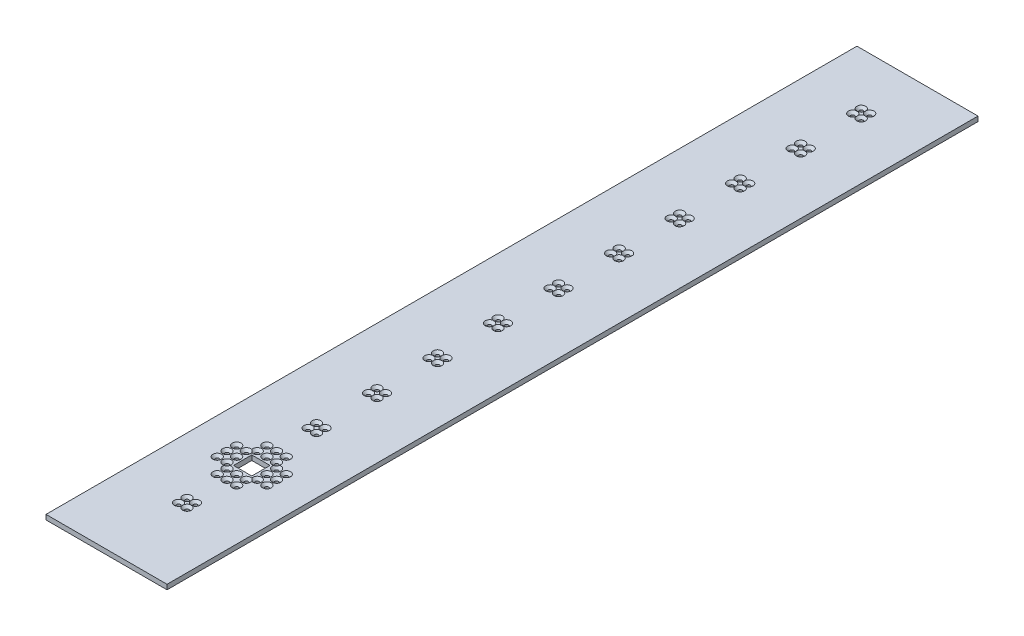
from build123d import *

# Parameters (mm, degrees)
SKETCH_1_W      = 100
SKETCH_1_H      = 670
SKETCH_1_R      = 1.6
SKETCH_1_W_2    = 15.1
SKETCH_1_H_2    = 15.1
EXTRUDE_1_DEPTH = 4
CHAMFER_1_SIZE  = 2


with BuildPart() as part:
    # 草图1 → 凸台-拉伸1 (new body)
    with BuildSketch(Plane(origin=(0, 0, 0), x_dir=(1, 0, 0), z_dir=(0, 1, 0))):
        Rectangle(SKETCH_1_W, SKETCH_1_H)
        with Locations(Location((0, -202.5, 0), (0, 0, 270))):
            Circle(SKETCH_1_R, mode=Mode.SUBTRACT)
        with Locations(Location((0, -194.5, 0), (0, 0, 270))):
            Circle(SKETCH_1_R, mode=Mode.SUBTRACT)
        with Locations(Location((8, -194.5, 0), (0, 0, 270))):
            Circle(SKETCH_1_R, mode=Mode.SUBTRACT)
        with Locations(Location((8, -202.5, 0), (0, 0, 270))):
            Circle(SKETCH_1_R, mode=Mode.SUBTRACT)
        with Locations(Location((-8, -194.5, 0), (0, 0, 270))):
            Circle(SKETCH_1_R, mode=Mode.SUBTRACT)
        with Locations(Location((-8, -202.5, 0), (0, 0, 270))):
            Circle(SKETCH_1_R, mode=Mode.SUBTRACT)
        with Locations(Location((20.5, -207, 0), (0, 0, 270))):
            Circle(SKETCH_1_R, mode=Mode.SUBTRACT)
        with Locations(Location((12.5, -207, 0), (0, 0, 270))):
            Circle(SKETCH_1_R, mode=Mode.SUBTRACT)
        with Locations(Location((12.5, -215, 0), (0, 0, 270))):
            Circle(SKETCH_1_R, mode=Mode.SUBTRACT)
        with Locations(Location((20.5, -215, 0), (0, 0, 270))):
            Circle(SKETCH_1_R, mode=Mode.SUBTRACT)
        with Locations(Location((20.5, -223, 0), (0, 0, 270))):
            Circle(SKETCH_1_R, mode=Mode.SUBTRACT)
        with Locations(Location((12.5, -223, 0), (0, 0, 270))):
            Circle(SKETCH_1_R, mode=Mode.SUBTRACT)
        with Locations(Location((8, -235.5, 0), (0, 0, 270))):
            Circle(SKETCH_1_R, mode=Mode.SUBTRACT)
        with Locations(Location((8, -227.5, 0), (0, 0, 270))):
            Circle(SKETCH_1_R, mode=Mode.SUBTRACT)
        with Locations(Location((0, -227.5, 0), (0, 0, 270))):
            Circle(SKETCH_1_R, mode=Mode.SUBTRACT)
        with Locations(Location((0, -235.5, 0), (0, 0, 270))):
            Circle(SKETCH_1_R, mode=Mode.SUBTRACT)
        with Locations(Location((-8, -235.5, 0), (0, 0, 270))):
            Circle(SKETCH_1_R, mode=Mode.SUBTRACT)
        with Locations(Location((-8, -227.5, 0), (0, 0, 270))):
            Circle(SKETCH_1_R, mode=Mode.SUBTRACT)
        with Locations(Location((-20.5, -223, 0), (0, 0, 270))):
            Circle(SKETCH_1_R, mode=Mode.SUBTRACT)
        with Locations(Location((-12.5, -223, 0), (0, 0, 270))):
            Circle(SKETCH_1_R, mode=Mode.SUBTRACT)
        with Locations(Location((-12.5, -215, 0), (0, 0, 270))):
            Circle(SKETCH_1_R, mode=Mode.SUBTRACT)
        with Locations(Location((-20.5, -215, 0), (0, 0, 270))):
            Circle(SKETCH_1_R, mode=Mode.SUBTRACT)
        with Locations(Location((-20.5, -207, 0), (0, 0, 270))):
            Circle(SKETCH_1_R, mode=Mode.SUBTRACT)
        with Locations(Location((-12.5, -207, 0), (0, 0, 270))):
            Circle(SKETCH_1_R, mode=Mode.SUBTRACT)
        with Locations(Location((-3.5, -165, 0), (0, 0, 270))):
            Circle(SKETCH_1_R, mode=Mode.SUBTRACT)
        with Locations(Location((3.5, -165, 0), (0, 0, 90))):
            Circle(SKETCH_1_R, mode=Mode.SUBTRACT)
        with Locations(Location((-3.5, -158, 0), (0, 0, 270))):
            Circle(SKETCH_1_R, mode=Mode.SUBTRACT)
        with Locations(Location((3.5, -158, 0), (0, 0, 90))):
            Circle(SKETCH_1_R, mode=Mode.SUBTRACT)
        with Locations(Location((-3.5, -108, 0), (0, 0, 270))):
            Circle(SKETCH_1_R, mode=Mode.SUBTRACT)
        with Locations(Location((-3.5, -115, 0), (0, 0, 270))):
            Circle(SKETCH_1_R, mode=Mode.SUBTRACT)
        with Locations(Location((3.5, -115, 0), (0, 0, 90))):
            Circle(SKETCH_1_R, mode=Mode.SUBTRACT)
        with Locations(Location((3.5, -108, 0), (0, 0, 90))):
            Circle(SKETCH_1_R, mode=Mode.SUBTRACT)
        with Locations(Location((-3.5, -58, 0), (0, 0, 270))):
            Circle(SKETCH_1_R, mode=Mode.SUBTRACT)
        with Locations(Location((-3.5, -65, 0), (0, 0, 270))):
            Circle(SKETCH_1_R, mode=Mode.SUBTRACT)
        with Locations(Location((3.5, -65, 0), (0, 0, 90))):
            Circle(SKETCH_1_R, mode=Mode.SUBTRACT)
        with Locations(Location((3.5, -58, 0), (0, 0, 90))):
            Circle(SKETCH_1_R, mode=Mode.SUBTRACT)
        with Locations(Location((-3.5, -8, 0), (0, 0, 270))):
            Circle(SKETCH_1_R, mode=Mode.SUBTRACT)
        with Locations(Location((-3.5, -15, 0), (0, 0, 270))):
            Circle(SKETCH_1_R, mode=Mode.SUBTRACT)
        with Locations(Location((3.5, -15, 0), (0, 0, 90))):
            Circle(SKETCH_1_R, mode=Mode.SUBTRACT)
        with Locations(Location((3.5, -8, 0), (0, 0, 90))):
            Circle(SKETCH_1_R, mode=Mode.SUBTRACT)
        with Locations(Location((-3.5, 42, 0), (0, 0, 270))):
            Circle(SKETCH_1_R, mode=Mode.SUBTRACT)
        with Locations(Location((-3.5, 35, 0), (0, 0, 270))):
            Circle(SKETCH_1_R, mode=Mode.SUBTRACT)
        with Locations(Location((3.5, 35, 0), (0, 0, 90))):
            Circle(SKETCH_1_R, mode=Mode.SUBTRACT)
        with Locations(Location((3.5, 42, 0), (0, 0, 90))):
            Circle(SKETCH_1_R, mode=Mode.SUBTRACT)
        with Locations(Location((-3.5, 92, 0), (0, 0, 270))):
            Circle(SKETCH_1_R, mode=Mode.SUBTRACT)
        with Locations(Location((-3.5, 85, 0), (0, 0, 270))):
            Circle(SKETCH_1_R, mode=Mode.SUBTRACT)
        with Locations(Location((3.5, 85, 0), (0, 0, 90))):
            Circle(SKETCH_1_R, mode=Mode.SUBTRACT)
        with Locations(Location((3.5, 92, 0), (0, 0, 90))):
            Circle(SKETCH_1_R, mode=Mode.SUBTRACT)
        with Locations(Location((-3.5, 142, 0), (0, 0, 270))):
            Circle(SKETCH_1_R, mode=Mode.SUBTRACT)
        with Locations(Location((-3.5, 135, 0), (0, 0, 270))):
            Circle(SKETCH_1_R, mode=Mode.SUBTRACT)
        with Locations(Location((3.5, 135, 0), (0, 0, 90))):
            Circle(SKETCH_1_R, mode=Mode.SUBTRACT)
        with Locations(Location((3.5, 142, 0), (0, 0, 90))):
            Circle(SKETCH_1_R, mode=Mode.SUBTRACT)
        with Locations(Location((-3.5, 192, 0), (0, 0, 270))):
            Circle(SKETCH_1_R, mode=Mode.SUBTRACT)
        with Locations(Location((-3.5, 185, 0), (0, 0, 270))):
            Circle(SKETCH_1_R, mode=Mode.SUBTRACT)
        with Locations(Location((3.5, 185, 0), (0, 0, 90))):
            Circle(SKETCH_1_R, mode=Mode.SUBTRACT)
        with Locations(Location((3.5, 192, 0), (0, 0, 90))):
            Circle(SKETCH_1_R, mode=Mode.SUBTRACT)
        with Locations(Location((-3.5, 242, 0), (0, 0, 270))):
            Circle(SKETCH_1_R, mode=Mode.SUBTRACT)
        with Locations(Location((-3.5, 235, 0), (0, 0, 270))):
            Circle(SKETCH_1_R, mode=Mode.SUBTRACT)
        with Locations(Location((3.5, 235, 0), (0, 0, 90))):
            Circle(SKETCH_1_R, mode=Mode.SUBTRACT)
        with Locations(Location((3.5, 242, 0), (0, 0, 90))):
            Circle(SKETCH_1_R, mode=Mode.SUBTRACT)
        with Locations(Location((-3.5, 292, 0), (0, 0, 270))):
            Circle(SKETCH_1_R, mode=Mode.SUBTRACT)
        with Locations(Location((-3.5, 285, 0), (0, 0, 270))):
            Circle(SKETCH_1_R, mode=Mode.SUBTRACT)
        with Locations(Location((3.5, 285, 0), (0, 0, 90))):
            Circle(SKETCH_1_R, mode=Mode.SUBTRACT)
        with Locations(Location((3.5, 292, 0), (0, 0, 90))):
            Circle(SKETCH_1_R, mode=Mode.SUBTRACT)
        with Locations(Location((3.5, -265, 0), (0, 0, 270))):
            Circle(SKETCH_1_R, mode=Mode.SUBTRACT)
        with Locations(Location((3.5, -272, 0), (0, 0, 270))):
            Circle(SKETCH_1_R, mode=Mode.SUBTRACT)
        with Locations(Location((-3.5, -272, 0), (0, 0, 90))):
            Circle(SKETCH_1_R, mode=Mode.SUBTRACT)
        with Locations(Location((-3.5, -265, 0), (0, 0, 90))):
            Circle(SKETCH_1_R, mode=Mode.SUBTRACT)
        with Locations((0, -215)):
            Rectangle(SKETCH_1_W_2, SKETCH_1_H_2, mode=Mode.SUBTRACT)
    extrude(amount=EXTRUDE_1_DEPTH)

    # 倒角1
    # the kernel refuses this chamfer: 2 mm, written as the material it takes off along each edge
    with BuildSketch(Plane(origin=(-20.5, 4, 215), x_dir=(0, 0, 1), z_dir=(-1, 0, 0))) as chamfer_1_piece_1:
        Polygon((1.6, -CHAMFER_1_SIZE), (1.6 + CHAMFER_1_SIZE, 0), (1.6, 0), align=None)
    chamfer_1_piece_1_solid = revolve(axis=Axis((-20.5, 4, 215), (0, 1, 0)), mode=Mode.PRIVATE)
    with BuildSketch(Plane(origin=(-12.5, 4, 207), x_dir=(0, 0, 1), z_dir=(-1, 0, 0))) as chamfer_1_piece_2:
        Polygon((1.6, -CHAMFER_1_SIZE), (1.6 + CHAMFER_1_SIZE, 0), (1.6, 0), align=None)
    chamfer_1_piece_2_solid = revolve(axis=Axis((-12.5, 4, 207), (0, 1, 0)), mode=Mode.PRIVATE)
    with BuildSketch(Plane(origin=(-20.5, 4, 207), x_dir=(0, 0, 1), z_dir=(-1, 0, 0))) as chamfer_1_piece_3:
        Polygon((1.6, -CHAMFER_1_SIZE), (1.6 + CHAMFER_1_SIZE, 0), (1.6, 0), align=None)
    chamfer_1_piece_3_solid = revolve(axis=Axis((-20.5, 4, 207), (0, 1, 0)), mode=Mode.PRIVATE)
    with BuildSketch(Plane(origin=(-12.5, 4, 223), x_dir=(0, 0, 1), z_dir=(-1, 0, 0))) as chamfer_1_piece_4:
        Polygon((1.6, -CHAMFER_1_SIZE), (1.6 + CHAMFER_1_SIZE, 0), (1.6, 0), align=None)
    chamfer_1_piece_4_solid = revolve(axis=Axis((-12.5, 4, 223), (0, 1, 0)), mode=Mode.PRIVATE)
    with BuildSketch(Plane(origin=(-20.5, 4, 223), x_dir=(0, 0, 1), z_dir=(-1, 0, 0))) as chamfer_1_piece_5:
        Polygon((1.6, -CHAMFER_1_SIZE), (1.6 + CHAMFER_1_SIZE, 0), (1.6, 0), align=None)
    chamfer_1_piece_5_solid = revolve(axis=Axis((-20.5, 4, 223), (0, 1, 0)), mode=Mode.PRIVATE)
    with BuildSketch(Plane(origin=(3.5, 4, 165), x_dir=(0, 0, -1), z_dir=(1, 0, 0))) as chamfer_1_piece_6:
        Polygon((1.6, -CHAMFER_1_SIZE), (1.6 + CHAMFER_1_SIZE, 0), (1.6, 0), align=None)
    chamfer_1_piece_6_solid = revolve(axis=Axis((3.5, 4, 165), (0, 1, 0)), mode=Mode.PRIVATE)
    with BuildSketch(Plane(origin=(-3.5, 4, 158), x_dir=(0, 0, 1), z_dir=(-1, 0, 0))) as chamfer_1_piece_7:
        Polygon((1.6, -CHAMFER_1_SIZE), (1.6 + CHAMFER_1_SIZE, 0), (1.6, 0), align=None)
    chamfer_1_piece_7_solid = revolve(axis=Axis((-3.5, 4, 158), (0, 1, 0)), mode=Mode.PRIVATE)
    with BuildSketch(Plane(origin=(3.5, 4, 158), x_dir=(0, 0, -1), z_dir=(1, 0, 0))) as chamfer_1_piece_8:
        Polygon((1.6, -CHAMFER_1_SIZE), (1.6 + CHAMFER_1_SIZE, 0), (1.6, 0), align=None)
    chamfer_1_piece_8_solid = revolve(axis=Axis((3.5, 4, 158), (0, 1, 0)), mode=Mode.PRIVATE)
    with BuildSketch(Plane(origin=(-3.5, 4, 115), x_dir=(0, 0, 1), z_dir=(-1, 0, 0))) as chamfer_1_piece_9:
        Polygon((1.6, -CHAMFER_1_SIZE), (1.6 + CHAMFER_1_SIZE, 0), (1.6, 0), align=None)
    chamfer_1_piece_9_solid = revolve(axis=Axis((-3.5, 4, 115), (0, 1, 0)), mode=Mode.PRIVATE)
    with BuildSketch(Plane(origin=(3.5, 4, 115), x_dir=(0, 0, -1), z_dir=(1, 0, 0))) as chamfer_1_piece_10:
        Polygon((1.6, -CHAMFER_1_SIZE), (1.6 + CHAMFER_1_SIZE, 0), (1.6, 0), align=None)
    chamfer_1_piece_10_solid = revolve(axis=Axis((3.5, 4, 115), (0, 1, 0)), mode=Mode.PRIVATE)
    with BuildSketch(Plane(origin=(-3.5, 4, 108), x_dir=(0, 0, 1), z_dir=(-1, 0, 0))) as chamfer_1_piece_11:
        Polygon((1.6, -CHAMFER_1_SIZE), (1.6 + CHAMFER_1_SIZE, 0), (1.6, 0), align=None)
    chamfer_1_piece_11_solid = revolve(axis=Axis((-3.5, 4, 108), (0, 1, 0)), mode=Mode.PRIVATE)
    with BuildSketch(Plane(origin=(3.5, 4, 108), x_dir=(0, 0, -1), z_dir=(1, 0, 0))) as chamfer_1_piece_12:
        Polygon((1.6, -CHAMFER_1_SIZE), (1.6 + CHAMFER_1_SIZE, 0), (1.6, 0), align=None)
    chamfer_1_piece_12_solid = revolve(axis=Axis((3.5, 4, 108), (0, 1, 0)), mode=Mode.PRIVATE)
    with BuildSketch(Plane(origin=(-3.5, 4, 65), x_dir=(0, 0, 1), z_dir=(-1, 0, 0))) as chamfer_1_piece_13:
        Polygon((1.6, -CHAMFER_1_SIZE), (1.6 + CHAMFER_1_SIZE, 0), (1.6, 0), align=None)
    chamfer_1_piece_13_solid = revolve(axis=Axis((-3.5, 4, 65), (0, 1, 0)), mode=Mode.PRIVATE)
    with BuildSketch(Plane(origin=(3.5, 4, 65), x_dir=(0, 0, -1), z_dir=(1, 0, 0))) as chamfer_1_piece_14:
        Polygon((1.6, -CHAMFER_1_SIZE), (1.6 + CHAMFER_1_SIZE, 0), (1.6, 0), align=None)
    chamfer_1_piece_14_solid = revolve(axis=Axis((3.5, 4, 65), (0, 1, 0)), mode=Mode.PRIVATE)
    with BuildSketch(Plane(origin=(-3.5, 4, 58), x_dir=(0, 0, 1), z_dir=(-1, 0, 0))) as chamfer_1_piece_15:
        Polygon((1.6, -CHAMFER_1_SIZE), (1.6 + CHAMFER_1_SIZE, 0), (1.6, 0), align=None)
    chamfer_1_piece_15_solid = revolve(axis=Axis((-3.5, 4, 58), (0, 1, 0)), mode=Mode.PRIVATE)
    with BuildSketch(Plane(origin=(3.5, 4, 58), x_dir=(0, 0, -1), z_dir=(1, 0, 0))) as chamfer_1_piece_16:
        Polygon((1.6, -CHAMFER_1_SIZE), (1.6 + CHAMFER_1_SIZE, 0), (1.6, 0), align=None)
    chamfer_1_piece_16_solid = revolve(axis=Axis((3.5, 4, 58), (0, 1, 0)), mode=Mode.PRIVATE)
    with BuildSketch(Plane(origin=(-3.5, 4, 15), x_dir=(0, 0, 1), z_dir=(-1, 0, 0))) as chamfer_1_piece_17:
        Polygon((1.6, -CHAMFER_1_SIZE), (1.6 + CHAMFER_1_SIZE, 0), (1.6, 0), align=None)
    chamfer_1_piece_17_solid = revolve(axis=Axis((-3.5, 4, 15), (0, 1, 0)), mode=Mode.PRIVATE)
    with BuildSketch(Plane(origin=(3.5, 4, 15), x_dir=(0, 0, -1), z_dir=(1, 0, 0))) as chamfer_1_piece_18:
        Polygon((1.6, -CHAMFER_1_SIZE), (1.6 + CHAMFER_1_SIZE, 0), (1.6, 0), align=None)
    chamfer_1_piece_18_solid = revolve(axis=Axis((3.5, 4, 15), (0, 1, 0)), mode=Mode.PRIVATE)
    with BuildSketch(Plane(origin=(-3.5, 4, 8), x_dir=(0, 0, 1), z_dir=(-1, 0, 0))) as chamfer_1_piece_19:
        Polygon((1.6, -CHAMFER_1_SIZE), (1.6 + CHAMFER_1_SIZE, 0), (1.6, 0), align=None)
    chamfer_1_piece_19_solid = revolve(axis=Axis((-3.5, 4, 8), (0, 1, 0)), mode=Mode.PRIVATE)
    with BuildSketch(Plane(origin=(3.5, 4, 8), x_dir=(0, 0, -1), z_dir=(1, 0, 0))) as chamfer_1_piece_20:
        Polygon((1.6, -CHAMFER_1_SIZE), (1.6 + CHAMFER_1_SIZE, 0), (1.6, 0), align=None)
    chamfer_1_piece_20_solid = revolve(axis=Axis((3.5, 4, 8), (0, 1, 0)), mode=Mode.PRIVATE)
    with BuildSketch(Plane(origin=(-3.5, 4, -35), x_dir=(0, 0, 1), z_dir=(-1, 0, 0))) as chamfer_1_piece_21:
        Polygon((1.6, -CHAMFER_1_SIZE), (1.6 + CHAMFER_1_SIZE, 0), (1.6, 0), align=None)
    chamfer_1_piece_21_solid = revolve(axis=Axis((-3.5, 4, -35), (0, 1, 0)), mode=Mode.PRIVATE)
    with BuildSketch(Plane(origin=(3.5, 4, -35), x_dir=(0, 0, -1), z_dir=(1, 0, 0))) as chamfer_1_piece_22:
        Polygon((1.6, -CHAMFER_1_SIZE), (1.6 + CHAMFER_1_SIZE, 0), (1.6, 0), align=None)
    chamfer_1_piece_22_solid = revolve(axis=Axis((3.5, 4, -35), (0, 1, 0)), mode=Mode.PRIVATE)
    with BuildSketch(Plane(origin=(-3.5, 4, -42), x_dir=(0, 0, 1), z_dir=(-1, 0, 0))) as chamfer_1_piece_23:
        Polygon((1.6, -CHAMFER_1_SIZE), (1.6 + CHAMFER_1_SIZE, 0), (1.6, 0), align=None)
    chamfer_1_piece_23_solid = revolve(axis=Axis((-3.5, 4, -42), (0, 1, 0)), mode=Mode.PRIVATE)
    with BuildSketch(Plane(origin=(3.5, 4, -42), x_dir=(0, 0, -1), z_dir=(1, 0, 0))) as chamfer_1_piece_24:
        Polygon((1.6, -CHAMFER_1_SIZE), (1.6 + CHAMFER_1_SIZE, 0), (1.6, 0), align=None)
    chamfer_1_piece_24_solid = revolve(axis=Axis((3.5, 4, -42), (0, 1, 0)), mode=Mode.PRIVATE)
    with BuildSketch(Plane(origin=(-3.5, 4, -85), x_dir=(0, 0, 1), z_dir=(-1, 0, 0))) as chamfer_1_piece_25:
        Polygon((1.6, -CHAMFER_1_SIZE), (1.6 + CHAMFER_1_SIZE, 0), (1.6, 0), align=None)
    chamfer_1_piece_25_solid = revolve(axis=Axis((-3.5, 4, -85), (0, 1, 0)), mode=Mode.PRIVATE)
    with BuildSketch(Plane(origin=(3.5, 4, -85), x_dir=(0, 0, -1), z_dir=(1, 0, 0))) as chamfer_1_piece_26:
        Polygon((1.6, -CHAMFER_1_SIZE), (1.6 + CHAMFER_1_SIZE, 0), (1.6, 0), align=None)
    chamfer_1_piece_26_solid = revolve(axis=Axis((3.5, 4, -85), (0, 1, 0)), mode=Mode.PRIVATE)
    with BuildSketch(Plane(origin=(-3.5, 4, -92), x_dir=(0, 0, 1), z_dir=(-1, 0, 0))) as chamfer_1_piece_27:
        Polygon((1.6, -CHAMFER_1_SIZE), (1.6 + CHAMFER_1_SIZE, 0), (1.6, 0), align=None)
    chamfer_1_piece_27_solid = revolve(axis=Axis((-3.5, 4, -92), (0, 1, 0)), mode=Mode.PRIVATE)
    with BuildSketch(Plane(origin=(3.5, 4, -92), x_dir=(0, 0, -1), z_dir=(1, 0, 0))) as chamfer_1_piece_28:
        Polygon((1.6, -CHAMFER_1_SIZE), (1.6 + CHAMFER_1_SIZE, 0), (1.6, 0), align=None)
    chamfer_1_piece_28_solid = revolve(axis=Axis((3.5, 4, -92), (0, 1, 0)), mode=Mode.PRIVATE)
    with BuildSketch(Plane(origin=(-3.5, 4, -135), x_dir=(0, 0, 1), z_dir=(-1, 0, 0))) as chamfer_1_piece_29:
        Polygon((1.6, -CHAMFER_1_SIZE), (1.6 + CHAMFER_1_SIZE, 0), (1.6, 0), align=None)
    chamfer_1_piece_29_solid = revolve(axis=Axis((-3.5, 4, -135), (0, 1, 0)), mode=Mode.PRIVATE)
    with BuildSketch(Plane(origin=(3.5, 4, -135), x_dir=(0, 0, -1), z_dir=(1, 0, 0))) as chamfer_1_piece_30:
        Polygon((1.6, -CHAMFER_1_SIZE), (1.6 + CHAMFER_1_SIZE, 0), (1.6, 0), align=None)
    chamfer_1_piece_30_solid = revolve(axis=Axis((3.5, 4, -135), (0, 1, 0)), mode=Mode.PRIVATE)
    with BuildSketch(Plane(origin=(-3.5, 4, -142), x_dir=(0, 0, 1), z_dir=(-1, 0, 0))) as chamfer_1_piece_31:
        Polygon((1.6, -CHAMFER_1_SIZE), (1.6 + CHAMFER_1_SIZE, 0), (1.6, 0), align=None)
    chamfer_1_piece_31_solid = revolve(axis=Axis((-3.5, 4, -142), (0, 1, 0)), mode=Mode.PRIVATE)
    with BuildSketch(Plane(origin=(3.5, 4, -142), x_dir=(0, 0, -1), z_dir=(1, 0, 0))) as chamfer_1_piece_32:
        Polygon((1.6, -CHAMFER_1_SIZE), (1.6 + CHAMFER_1_SIZE, 0), (1.6, 0), align=None)
    chamfer_1_piece_32_solid = revolve(axis=Axis((3.5, 4, -142), (0, 1, 0)), mode=Mode.PRIVATE)
    with BuildSketch(Plane(origin=(-3.5, 4, -185), x_dir=(0, 0, 1), z_dir=(-1, 0, 0))) as chamfer_1_piece_33:
        Polygon((1.6, -CHAMFER_1_SIZE), (1.6 + CHAMFER_1_SIZE, 0), (1.6, 0), align=None)
    chamfer_1_piece_33_solid = revolve(axis=Axis((-3.5, 4, -185), (0, 1, 0)), mode=Mode.PRIVATE)
    with BuildSketch(Plane(origin=(3.5, 4, -185), x_dir=(0, 0, -1), z_dir=(1, 0, 0))) as chamfer_1_piece_34:
        Polygon((1.6, -CHAMFER_1_SIZE), (1.6 + CHAMFER_1_SIZE, 0), (1.6, 0), align=None)
    chamfer_1_piece_34_solid = revolve(axis=Axis((3.5, 4, -185), (0, 1, 0)), mode=Mode.PRIVATE)
    with BuildSketch(Plane(origin=(-3.5, 4, -192), x_dir=(0, 0, 1), z_dir=(-1, 0, 0))) as chamfer_1_piece_35:
        Polygon((1.6, -CHAMFER_1_SIZE), (1.6 + CHAMFER_1_SIZE, 0), (1.6, 0), align=None)
    chamfer_1_piece_35_solid = revolve(axis=Axis((-3.5, 4, -192), (0, 1, 0)), mode=Mode.PRIVATE)
    with BuildSketch(Plane(origin=(3.5, 4, -192), x_dir=(0, 0, -1), z_dir=(1, 0, 0))) as chamfer_1_piece_36:
        Polygon((1.6, -CHAMFER_1_SIZE), (1.6 + CHAMFER_1_SIZE, 0), (1.6, 0), align=None)
    chamfer_1_piece_36_solid = revolve(axis=Axis((3.5, 4, -192), (0, 1, 0)), mode=Mode.PRIVATE)
    with BuildSketch(Plane(origin=(-3.5, 4, -235), x_dir=(0, 0, 1), z_dir=(-1, 0, 0))) as chamfer_1_piece_37:
        Polygon((1.6, -CHAMFER_1_SIZE), (1.6 + CHAMFER_1_SIZE, 0), (1.6, 0), align=None)
    chamfer_1_piece_37_solid = revolve(axis=Axis((-3.5, 4, -235), (0, 1, 0)), mode=Mode.PRIVATE)
    with BuildSketch(Plane(origin=(3.5, 4, -235), x_dir=(0, 0, -1), z_dir=(1, 0, 0))) as chamfer_1_piece_38:
        Polygon((1.6, -CHAMFER_1_SIZE), (1.6 + CHAMFER_1_SIZE, 0), (1.6, 0), align=None)
    chamfer_1_piece_38_solid = revolve(axis=Axis((3.5, 4, -235), (0, 1, 0)), mode=Mode.PRIVATE)
    with BuildSketch(Plane(origin=(-3.5, 4, -242), x_dir=(0, 0, 1), z_dir=(-1, 0, 0))) as chamfer_1_piece_39:
        Polygon((1.6, -CHAMFER_1_SIZE), (1.6 + CHAMFER_1_SIZE, 0), (1.6, 0), align=None)
    chamfer_1_piece_39_solid = revolve(axis=Axis((-3.5, 4, -242), (0, 1, 0)), mode=Mode.PRIVATE)
    with BuildSketch(Plane(origin=(3.5, 4, -242), x_dir=(0, 0, -1), z_dir=(1, 0, 0))) as chamfer_1_piece_40:
        Polygon((1.6, -CHAMFER_1_SIZE), (1.6 + CHAMFER_1_SIZE, 0), (1.6, 0), align=None)
    chamfer_1_piece_40_solid = revolve(axis=Axis((3.5, 4, -242), (0, 1, 0)), mode=Mode.PRIVATE)
    with BuildSketch(Plane(origin=(-3.5, 4, -285), x_dir=(0, 0, 1), z_dir=(-1, 0, 0))) as chamfer_1_piece_41:
        Polygon((1.6, -CHAMFER_1_SIZE), (1.6 + CHAMFER_1_SIZE, 0), (1.6, 0), align=None)
    chamfer_1_piece_41_solid = revolve(axis=Axis((-3.5, 4, -285), (0, 1, 0)), mode=Mode.PRIVATE)
    with BuildSketch(Plane(origin=(3.5, 4, -285), x_dir=(0, 0, -1), z_dir=(1, 0, 0))) as chamfer_1_piece_42:
        Polygon((1.6, -CHAMFER_1_SIZE), (1.6 + CHAMFER_1_SIZE, 0), (1.6, 0), align=None)
    chamfer_1_piece_42_solid = revolve(axis=Axis((3.5, 4, -285), (0, 1, 0)), mode=Mode.PRIVATE)
    with BuildSketch(Plane(origin=(0, 4, 202.5), x_dir=(0, 0, 1), z_dir=(-1, 0, 0))) as chamfer_1_piece_43:
        Polygon((1.6, -CHAMFER_1_SIZE), (1.6 + CHAMFER_1_SIZE, 0), (1.6, 0), align=None)
    chamfer_1_piece_43_solid = revolve(axis=Axis((0, 4, 202.5), (0, 1, 0)), mode=Mode.PRIVATE)
    with BuildSketch(Plane(origin=(-3.5, 4, -292), x_dir=(0, 0, 1), z_dir=(-1, 0, 0))) as chamfer_1_piece_44:
        Polygon((1.6, -CHAMFER_1_SIZE), (1.6 + CHAMFER_1_SIZE, 0), (1.6, 0), align=None)
    chamfer_1_piece_44_solid = revolve(axis=Axis((-3.5, 4, -292), (0, 1, 0)), mode=Mode.PRIVATE)
    with BuildSketch(Plane(origin=(3.5, 4, -292), x_dir=(0, 0, -1), z_dir=(1, 0, 0))) as chamfer_1_piece_45:
        Polygon((1.6, -CHAMFER_1_SIZE), (1.6 + CHAMFER_1_SIZE, 0), (1.6, 0), align=None)
    chamfer_1_piece_45_solid = revolve(axis=Axis((3.5, 4, -292), (0, 1, 0)), mode=Mode.PRIVATE)
    with BuildSketch(Plane(origin=(3.5, 4, 265), x_dir=(0, 0, 1), z_dir=(-1, 0, 0))) as chamfer_1_piece_46:
        Polygon((1.6, -CHAMFER_1_SIZE), (1.6 + CHAMFER_1_SIZE, 0), (1.6, 0), align=None)
    chamfer_1_piece_46_solid = revolve(axis=Axis((3.5, 4, 265), (0, 1, 0)), mode=Mode.PRIVATE)
    with BuildSketch(Plane(origin=(3.5, 4, 272), x_dir=(0, 0, 1), z_dir=(-1, 0, 0))) as chamfer_1_piece_47:
        Polygon((1.6, -CHAMFER_1_SIZE), (1.6 + CHAMFER_1_SIZE, 0), (1.6, 0), align=None)
    chamfer_1_piece_47_solid = revolve(axis=Axis((3.5, 4, 272), (0, 1, 0)), mode=Mode.PRIVATE)
    with BuildSketch(Plane(origin=(-3.5, 4, 272), x_dir=(0, 0, -1), z_dir=(1, 0, 0))) as chamfer_1_piece_48:
        Polygon((1.6, -CHAMFER_1_SIZE), (1.6 + CHAMFER_1_SIZE, 0), (1.6, 0), align=None)
    chamfer_1_piece_48_solid = revolve(axis=Axis((-3.5, 4, 272), (0, 1, 0)), mode=Mode.PRIVATE)
    with BuildSketch(Plane(origin=(-3.5, 4, 265), x_dir=(0, 0, -1), z_dir=(1, 0, 0))) as chamfer_1_piece_49:
        Polygon((1.6, -CHAMFER_1_SIZE), (1.6 + CHAMFER_1_SIZE, 0), (1.6, 0), align=None)
    chamfer_1_piece_49_solid = revolve(axis=Axis((-3.5, 4, 265), (0, 1, 0)), mode=Mode.PRIVATE)
    with BuildSketch(Plane(origin=(0, 4, 194.5), x_dir=(0, 0, 1), z_dir=(-1, 0, 0))) as chamfer_1_piece_50:
        Polygon((1.6, -CHAMFER_1_SIZE), (1.6 + CHAMFER_1_SIZE, 0), (1.6, 0), align=None)
    chamfer_1_piece_50_solid = revolve(axis=Axis((0, 4, 194.5), (0, 1, 0)), mode=Mode.PRIVATE)
    with BuildSketch(Plane(origin=(8, 4, 202.5), x_dir=(0, 0, 1), z_dir=(-1, 0, 0))) as chamfer_1_piece_51:
        Polygon((1.6, -CHAMFER_1_SIZE), (1.6 + CHAMFER_1_SIZE, 0), (1.6, 0), align=None)
    chamfer_1_piece_51_solid = revolve(axis=Axis((8, 4, 202.5), (0, 1, 0)), mode=Mode.PRIVATE)
    with BuildSketch(Plane(origin=(8, 4, 194.5), x_dir=(0, 0, 1), z_dir=(-1, 0, 0))) as chamfer_1_piece_52:
        Polygon((1.6, -CHAMFER_1_SIZE), (1.6 + CHAMFER_1_SIZE, 0), (1.6, 0), align=None)
    chamfer_1_piece_52_solid = revolve(axis=Axis((8, 4, 194.5), (0, 1, 0)), mode=Mode.PRIVATE)
    with BuildSketch(Plane(origin=(-8, 4, 202.5), x_dir=(0, 0, 1), z_dir=(-1, 0, 0))) as chamfer_1_piece_53:
        Polygon((1.6, -CHAMFER_1_SIZE), (1.6 + CHAMFER_1_SIZE, 0), (1.6, 0), align=None)
    chamfer_1_piece_53_solid = revolve(axis=Axis((-8, 4, 202.5), (0, 1, 0)), mode=Mode.PRIVATE)
    with BuildSketch(Plane(origin=(-8, 4, 194.5), x_dir=(0, 0, 1), z_dir=(-1, 0, 0))) as chamfer_1_piece_54:
        Polygon((1.6, -CHAMFER_1_SIZE), (1.6 + CHAMFER_1_SIZE, 0), (1.6, 0), align=None)
    chamfer_1_piece_54_solid = revolve(axis=Axis((-8, 4, 194.5), (0, 1, 0)), mode=Mode.PRIVATE)
    with BuildSketch(Plane(origin=(-3.5, 4, 165), x_dir=(0, 0, 1), z_dir=(-1, 0, 0))) as chamfer_1_piece_55:
        Polygon((1.6, -CHAMFER_1_SIZE), (1.6 + CHAMFER_1_SIZE, 0), (1.6, 0), align=None)
    chamfer_1_piece_55_solid = revolve(axis=Axis((-3.5, 4, 165), (0, 1, 0)), mode=Mode.PRIVATE)
    with BuildSketch(Plane(origin=(12.5, 4, 215), x_dir=(0, 0, 1), z_dir=(-1, 0, 0))) as chamfer_1_piece_56:
        Polygon((1.6, -CHAMFER_1_SIZE), (1.6 + CHAMFER_1_SIZE, 0), (1.6, 0), align=None)
    chamfer_1_piece_56_solid = revolve(axis=Axis((12.5, 4, 215), (0, 1, 0)), mode=Mode.PRIVATE)
    with BuildSketch(Plane(origin=(20.5, 4, 215), x_dir=(0, 0, 1), z_dir=(-1, 0, 0))) as chamfer_1_piece_57:
        Polygon((1.6, -CHAMFER_1_SIZE), (1.6 + CHAMFER_1_SIZE, 0), (1.6, 0), align=None)
    chamfer_1_piece_57_solid = revolve(axis=Axis((20.5, 4, 215), (0, 1, 0)), mode=Mode.PRIVATE)
    with BuildSketch(Plane(origin=(12.5, 4, 223), x_dir=(0, 0, 1), z_dir=(-1, 0, 0))) as chamfer_1_piece_58:
        Polygon((1.6, -CHAMFER_1_SIZE), (1.6 + CHAMFER_1_SIZE, 0), (1.6, 0), align=None)
    chamfer_1_piece_58_solid = revolve(axis=Axis((12.5, 4, 223), (0, 1, 0)), mode=Mode.PRIVATE)
    with BuildSketch(Plane(origin=(20.5, 4, 223), x_dir=(0, 0, 1), z_dir=(-1, 0, 0))) as chamfer_1_piece_59:
        Polygon((1.6, -CHAMFER_1_SIZE), (1.6 + CHAMFER_1_SIZE, 0), (1.6, 0), align=None)
    chamfer_1_piece_59_solid = revolve(axis=Axis((20.5, 4, 223), (0, 1, 0)), mode=Mode.PRIVATE)
    with BuildSketch(Plane(origin=(12.5, 4, 207), x_dir=(0, 0, 1), z_dir=(-1, 0, 0))) as chamfer_1_piece_60:
        Polygon((1.6, -CHAMFER_1_SIZE), (1.6 + CHAMFER_1_SIZE, 0), (1.6, 0), align=None)
    chamfer_1_piece_60_solid = revolve(axis=Axis((12.5, 4, 207), (0, 1, 0)), mode=Mode.PRIVATE)
    with BuildSketch(Plane(origin=(20.5, 4, 207), x_dir=(0, 0, 1), z_dir=(-1, 0, 0))) as chamfer_1_piece_61:
        Polygon((1.6, -CHAMFER_1_SIZE), (1.6 + CHAMFER_1_SIZE, 0), (1.6, 0), align=None)
    chamfer_1_piece_61_solid = revolve(axis=Axis((20.5, 4, 207), (0, 1, 0)), mode=Mode.PRIVATE)
    with BuildSketch(Plane(origin=(0, 4, 227.5), x_dir=(0, 0, 1), z_dir=(-1, 0, 0))) as chamfer_1_piece_62:
        Polygon((1.6, -CHAMFER_1_SIZE), (1.6 + CHAMFER_1_SIZE, 0), (1.6, 0), align=None)
    chamfer_1_piece_62_solid = revolve(axis=Axis((0, 4, 227.5), (0, 1, 0)), mode=Mode.PRIVATE)
    with BuildSketch(Plane(origin=(0, 4, 235.5), x_dir=(0, 0, 1), z_dir=(-1, 0, 0))) as chamfer_1_piece_63:
        Polygon((1.6, -CHAMFER_1_SIZE), (1.6 + CHAMFER_1_SIZE, 0), (1.6, 0), align=None)
    chamfer_1_piece_63_solid = revolve(axis=Axis((0, 4, 235.5), (0, 1, 0)), mode=Mode.PRIVATE)
    with BuildSketch(Plane(origin=(-8, 4, 227.5), x_dir=(0, 0, 1), z_dir=(-1, 0, 0))) as chamfer_1_piece_64:
        Polygon((1.6, -CHAMFER_1_SIZE), (1.6 + CHAMFER_1_SIZE, 0), (1.6, 0), align=None)
    chamfer_1_piece_64_solid = revolve(axis=Axis((-8, 4, 227.5), (0, 1, 0)), mode=Mode.PRIVATE)
    with BuildSketch(Plane(origin=(-8, 4, 235.5), x_dir=(0, 0, 1), z_dir=(-1, 0, 0))) as chamfer_1_piece_65:
        Polygon((1.6, -CHAMFER_1_SIZE), (1.6 + CHAMFER_1_SIZE, 0), (1.6, 0), align=None)
    chamfer_1_piece_65_solid = revolve(axis=Axis((-8, 4, 235.5), (0, 1, 0)), mode=Mode.PRIVATE)
    with BuildSketch(Plane(origin=(8, 4, 227.5), x_dir=(0, 0, 1), z_dir=(-1, 0, 0))) as chamfer_1_piece_66:
        Polygon((1.6, -CHAMFER_1_SIZE), (1.6 + CHAMFER_1_SIZE, 0), (1.6, 0), align=None)
    chamfer_1_piece_66_solid = revolve(axis=Axis((8, 4, 227.5), (0, 1, 0)), mode=Mode.PRIVATE)
    with BuildSketch(Plane(origin=(8, 4, 235.5), x_dir=(0, 0, 1), z_dir=(-1, 0, 0))) as chamfer_1_piece_67:
        Polygon((1.6, -CHAMFER_1_SIZE), (1.6 + CHAMFER_1_SIZE, 0), (1.6, 0), align=None)
    chamfer_1_piece_67_solid = revolve(axis=Axis((8, 4, 235.5), (0, 1, 0)), mode=Mode.PRIVATE)
    with BuildSketch(Plane(origin=(-12.5, 4, 215), x_dir=(0, 0, 1), z_dir=(-1, 0, 0))) as chamfer_1_piece_68:
        Polygon((1.6, -CHAMFER_1_SIZE), (1.6 + CHAMFER_1_SIZE, 0), (1.6, 0), align=None)
    chamfer_1_piece_68_solid = revolve(axis=Axis((-12.5, 4, 215), (0, 1, 0)), mode=Mode.PRIVATE)
    add([chamfer_1_piece_1_solid, chamfer_1_piece_2_solid, chamfer_1_piece_3_solid, chamfer_1_piece_4_solid, chamfer_1_piece_5_solid, chamfer_1_piece_6_solid, chamfer_1_piece_7_solid, chamfer_1_piece_8_solid, chamfer_1_piece_9_solid, chamfer_1_piece_10_solid, chamfer_1_piece_11_solid, chamfer_1_piece_12_solid, chamfer_1_piece_13_solid, chamfer_1_piece_14_solid, chamfer_1_piece_15_solid, chamfer_1_piece_16_solid, chamfer_1_piece_17_solid, chamfer_1_piece_18_solid, chamfer_1_piece_19_solid, chamfer_1_piece_20_solid, chamfer_1_piece_21_solid, chamfer_1_piece_22_solid, chamfer_1_piece_23_solid, chamfer_1_piece_24_solid, chamfer_1_piece_25_solid, chamfer_1_piece_26_solid, chamfer_1_piece_27_solid, chamfer_1_piece_28_solid, chamfer_1_piece_29_solid, chamfer_1_piece_30_solid, chamfer_1_piece_31_solid, chamfer_1_piece_32_solid, chamfer_1_piece_33_solid, chamfer_1_piece_34_solid, chamfer_1_piece_35_solid, chamfer_1_piece_36_solid, chamfer_1_piece_37_solid, chamfer_1_piece_38_solid, chamfer_1_piece_39_solid, chamfer_1_piece_40_solid, chamfer_1_piece_41_solid, chamfer_1_piece_42_solid, chamfer_1_piece_43_solid, chamfer_1_piece_44_solid, chamfer_1_piece_45_solid, chamfer_1_piece_46_solid, chamfer_1_piece_47_solid, chamfer_1_piece_48_solid, chamfer_1_piece_49_solid, chamfer_1_piece_50_solid, chamfer_1_piece_51_solid, chamfer_1_piece_52_solid, chamfer_1_piece_53_solid, chamfer_1_piece_54_solid, chamfer_1_piece_55_solid, chamfer_1_piece_56_solid, chamfer_1_piece_57_solid, chamfer_1_piece_58_solid, chamfer_1_piece_59_solid, chamfer_1_piece_60_solid, chamfer_1_piece_61_solid, chamfer_1_piece_62_solid, chamfer_1_piece_63_solid, chamfer_1_piece_64_solid, chamfer_1_piece_65_solid, chamfer_1_piece_66_solid, chamfer_1_piece_67_solid, chamfer_1_piece_68_solid], mode=Mode.SUBTRACT)


solid = part.part
